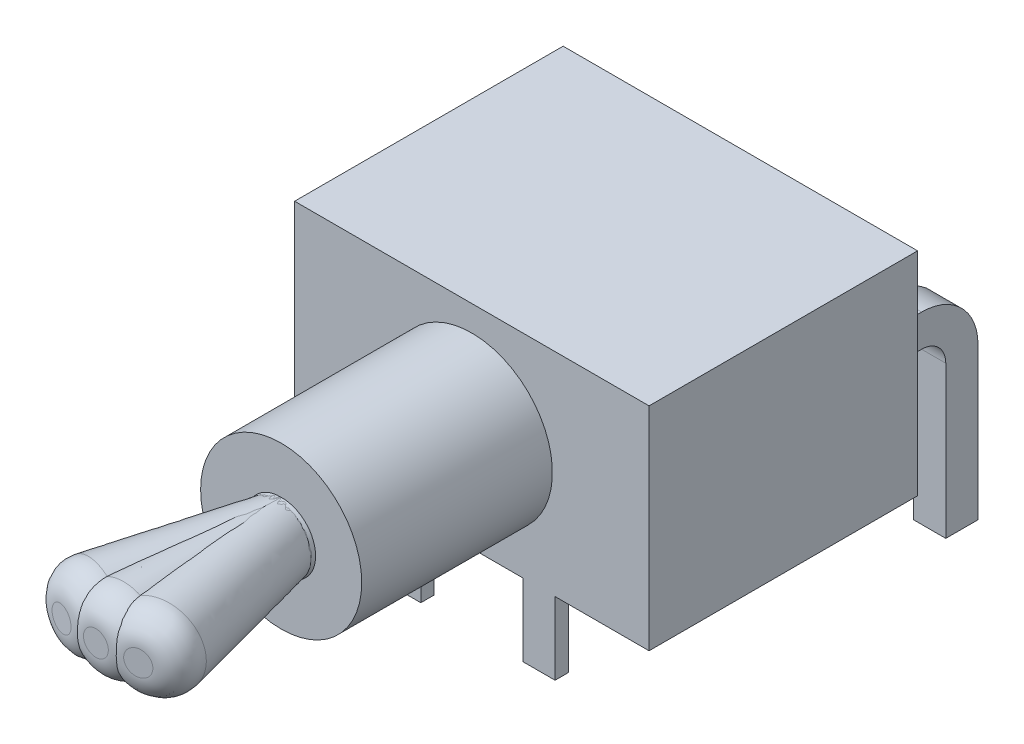
from build123d import *

# Parameters (mm, degrees)
SKETCH_1_W      = 13.2
SKETCH_1_H      = 7.9
EXTRUDE_1_DEPTH = 10
SKETCH_2_R      = 3
EXTRUDE_2_DEPTH = 7.1
SKETCH_3_W      = 1.2
SKETCH_3_H      = 0.5
EXTRUDE_3_DEPTH = 2.7
SKETCH_5_W      = 1.2
SKETCH_5_H      = 1.2
SKETCH_7_R      = 1.25
SKETCH_8_R      = 1.5
FILLET_1_R      = 1
FILLET_2_R      = 1


with BuildPart() as part:
    # Эскиз1 → Бобышка-Вытянуть1 (new body)
    with BuildSketch(Plane.XY):
        with Locations((6.6, 3.95)):
            Rectangle(SKETCH_1_W, SKETCH_1_H)
    extrude(amount=EXTRUDE_1_DEPTH)

    # Эскиз2 → Бобышка-Вытянуть2 (add)
    with BuildSketch(Plane.XY.offset(10)):
        with Locations(Location((6.6, 3.95, 0), (0, 0, 180))):
            Circle(SKETCH_2_R)
    extrude(amount=EXTRUDE_2_DEPTH)

    # Эскиз3 → Бобышка-Вытянуть3 (add)
    with BuildSketch(Plane.XZ):
        with Locations((4.1, 9.75)):
            Rectangle(SKETCH_3_W, SKETCH_3_H)
        with Locations((9.1, 9.75)):
            Rectangle(SKETCH_3_W, SKETCH_3_H)
    extrude(amount=EXTRUDE_3_DEPTH)

    # По траектории1: sweep along a path in Эскиз4
    with BuildLine(Plane(origin=(6.6, 0, 0), x_dir=(0, 0, -1), z_dir=(1, 0, 0))) as sweep_1_path:
        Line((0, 3.95), (1.45, 3.95))
        ThreePointArc((1.45, 3.95), (2.510660172, 3.510660172), (2.95, 2.45))
        Line((2.95, 2.45), (2.95, -3.2))
    # Эскиз5 → По траектории1 (sweep)
    with BuildSketch(Plane(origin=(0, 0, 0), x_dir=(-1, 0, 0), z_dir=(0, 0, -1))):
        with Locations((-11.3, 3.95)):
            Rectangle(SKETCH_5_W, SKETCH_5_H)
        with Locations((-6.6, 3.95)):
            Rectangle(SKETCH_5_W, SKETCH_5_H)
        with Locations((-1.9, 3.95)):
            Rectangle(SKETCH_5_W, SKETCH_5_H)
    sweep(path=sweep_1_path.line)


with BuildPart() as body_2:
    # Эскиз7 → По сечениям1 section 0
    with BuildSketch(Plane.XY.offset(17.1)):
        with Locations((6.6, 3.95)):
            Circle(SKETCH_7_R)
    # Эскиз8 → По сечениям1 section 1
    with BuildSketch(Plane.XY.offset(24)):
        with Locations((6.6, 3.95)):
            Circle(SKETCH_8_R)
    loft()

    # Скругление1
    fillet_1_edges = [body_2.edges().sort_by_distance(p)[0] for p in [
        (5.1, 3.95, 24),
    ]]
    fillet(fillet_1_edges, radius=FILLET_1_R)


with BuildPart() as body_3:
    # По сечениям2: read off the stored shape, not the designer's step
    # По сечениям2: loft between two sections, ruled curve by curve
    loft_2_from = [
        Edge.make_bspline([(5.433091339, 5.424825078, 23.906116012), (5.553307723, 5.402019896, 23.931668793), (5.686583986, 5.361277781, 23.959997537), (5.966038234, 5.217135548, 24.019397371), (6.112650493, 5.112839393, 24.050560769), (6.377575316, 4.818486115, 24.106872279), (6.494816858, 4.626897869, 24.131792738), (6.633696541, 4.178239532, 24.161312525), (6.652619613, 3.922141999, 24.165334748), (6.563392277, 3.430533639, 24.146368893), (6.45585936, 3.198424948, 24.123512066), (6.168782027, 2.83057113, 24.062491895), (5.992113228, 2.694738003, 24.024939782), (5.641530163, 2.517147255, 23.950421052), (5.468078321, 2.473567616, 23.913552724), (5.156644997, 2.441517413, 23.847355528), (5.017943712, 2.45236974, 23.81787366), (4.777510943, 2.497980104, 23.766768097), (4.64423468, 2.538722219, 23.738439353), (4.364780433, 2.682864452, 23.679039519), (4.218168173, 2.787160607, 23.647876121), (3.95324335, 3.081513885, 23.591564612), (3.836001809, 3.273102131, 23.566644153), (3.697122126, 3.721760468, 23.537124365), (3.678199054, 3.977858001, 23.533102142), (3.767426389, 4.469466361, 23.552067997), (3.874959306, 4.701575052, 23.574924824), (4.162036639, 5.06942887, 23.635944995), (4.338705439, 5.205261997, 23.673497108), (4.689288503, 5.382852745, 23.748015838), (4.862740345, 5.426432384, 23.784884166), (5.17417367, 5.458482587, 23.851081362), (5.312874955, 5.44763026, 23.880563231), (5.433091339, 5.424825078, 23.906116012)], [0, 0, 0, 0, 0.0625, 0.0625, 0.125, 0.125, 0.1875, 0.1875, 0.25, 0.25, 0.3125, 0.3125, 0.375, 0.375, 0.4375, 0.4375, 0.5, 0.5, 0.5625, 0.5625, 0.625, 0.625, 0.6875, 0.6875, 0.75, 0.75, 0.8125, 0.8125, 0.875, 0.875, 0.9375, 0.9375, 1, 1, 1, 1], 3),
    ]
    loft_2_to = [
        Edge.make_bspline([(6.892264264, 5.172738905, 17.1), (6.994159173, 5.151102778, 17.1), (7.10679174, 5.11423757, 17.1), (7.341699892, 4.988026352, 17.1), (7.4643261, 4.897924362, 17.1), (7.683635702, 4.646897651, 17.1), (7.779374075, 4.48472092, 17.1), (7.888022902, 4.10791535, 17.1), (7.898641895, 3.894156288, 17.1), (7.812097385, 3.486576653, 17.1), (7.715532806, 3.295576701, 17.1), (7.463142233, 2.995433396, 17.1), (7.30976342, 2.886153627, 17.1), (7.007371089, 2.745903889, 17.1), (6.858712292, 2.713405925, 17.1), (6.592786588, 2.693540601, 17.1), (6.474892114, 2.705624967, 17.1), (6.271102296, 2.748897222, 17.1), (6.158469729, 2.78576243, 17.1), (5.923561577, 2.911973648, 17.1), (5.800935369, 3.002075638, 17.1), (5.581625767, 3.253102349, 17.1), (5.485887394, 3.41527908, 17.1), (5.377238567, 3.79208465, 17.1), (5.366619574, 4.005843712, 17.1), (5.453164084, 4.413423347, 17.1), (5.549728663, 4.604423299, 17.1), (5.802119236, 4.904566604, 17.1), (5.955498049, 5.013846373, 17.1), (6.25789038, 5.154096111, 17.1), (6.406549177, 5.186594075, 17.1), (6.672474881, 5.206459399, 17.1), (6.790369355, 5.194375033, 17.1), (6.892264264, 5.172738905, 17.1)], [0, 0, 0, 0, 0.0625, 0.0625, 0.125, 0.125, 0.1875, 0.1875, 0.25, 0.25, 0.3125, 0.3125, 0.375, 0.375, 0.4375, 0.4375, 0.5, 0.5, 0.5625, 0.5625, 0.625, 0.625, 0.6875, 0.6875, 0.75, 0.75, 0.8125, 0.8125, 0.875, 0.875, 0.9375, 0.9375, 1, 1, 1, 1], 3),
    ]
    loft_2 = Solid(Shell([*[Face.make_surface_from_curves(loft_2_from[k], loft_2_to[k]) for k in range(1)], Face(Wire(loft_2_from)), Face(Wire(loft_2_to))]))
    add(loft_2)

    # Скругление2
    fillet_2_edges = [body_3.edges().sort_by_distance(p)[0] for p in [
        (4.897727328, 2.475174922, 23.792320878),
    ]]
    fillet(fillet_2_edges, radius=FILLET_2_R)


with BuildPart() as body_4:
    # Зеркальное отражение1: mirrored copy
    add(body_3.part.mirror(Plane(origin=(6.6, 0, 0), x_dir=(0, 0, 1), z_dir=(1, 0, 0))))


solid = Compound([part.part, body_2.part, body_3.part, body_4.part])
